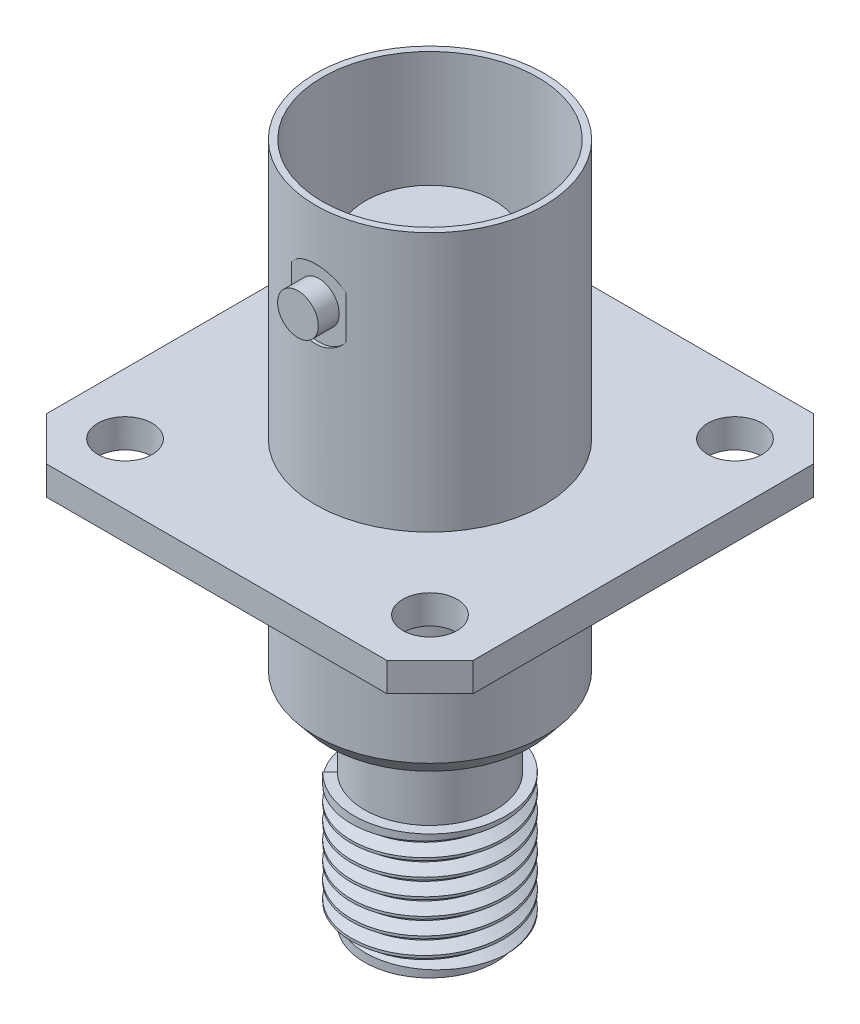
from build123d import *
from build123d.topology import SkipClean

# Parameters (mm, degrees)
BOSS_EXTRUDE2_START = 4.5
SKETCH5_R           = 0.846945363
BOSS_EXTRUDE2_DEPTH = 1
SKETCH6_R           = 0.645187132
CUT_EXTRUDE1_DEPTH  = 5
SKETCH9_W           = 0.137399245
SKETCH9_H           = 0.594121804
BOSS_EXTRUDE3_START = 3
BOSS_EXTRUDE3_DEPTH = 3
SKETCH14_W          = 17.78
SKETCH14_H          = 17.78
BOSS_EXTRUDE4_DEPTH = 1.2
SKETCH11_R          = 0.94402027
CUT_EXTRUDE2_DEPTH  = 3
SKETCH13_R          = 0.99938664
SKETCH13_R_2        = 0.759397748
CUT_EXTRUDE4_DEPTH  = 4
CUT_EXTRUDE5_REACH  = 22.361
SKETCH15_R          = 1.1303
SKETCH16_W          = 33.761193886
SKETCH16_H          = 12.105905612
CUT_EXTRUDE6_DEPTH  = 7
SKETCH17_R          = 2.7305
SKETCH17_R_2        = 2.05
BOSS_EXTRUDE5_DEPTH = 8
BOSS_EXTRUDE6_START = -5
SKETCH18_R          = 3.16357
SKETCH18_R_2        = 2.05
BOSS_EXTRUDE6_DEPTH = 5
SKETCH19_R          = 2.7305
SKETCH19_R_2        = 2.05
BOSS_EXTRUDE7_DEPTH = 0.5
CUT_SWEEP1_PITCH    = 0.7055
SKETCH22_R          = 2.05
BOSS_EXTRUDE8_DEPTH = 24.264969419


with BuildPart() as part:
    # Sketch1 → Revolve1 (revolve)
    with BuildSketch(Plane.XY, mode=Mode.PRIVATE) as revolve1_sk:
        Polygon((0, 7.249356935), (-2.68096621, 7.249356935), (-2.68096621, 0), (-4.484856827, 0), (-4.484856827, 10.8), (-4.7625, 10.8), (-4.7625, 0), (-6.35, 0), (-6.35, -1.2), (-4.7625, -1.2), (-4.7625, -8.33684753), (-4.138651138, -9.1), (-4.138651138, -11.4), (-1.05, -11.4), (-1.05, -13.015612484), (0, -13.015612484), align=None)
    revolve(revolve1_sk.sketch.rotate(Axis((0, 72.402332312, 0), (0, -1, 0)), 270), axis=Axis((0, 72.402332312, 0), (0, -1, 0)))

    # Sketch5 → Boss-Extrude2 (add)
    with BuildSketch(Plane.XY.offset(BOSS_EXTRUDE2_START)):
        with Locations(Location((0, 7.245112304, 0), (0, 0, 270))):
            Circle(SKETCH5_R)
    boss_extrude2 = extrude(amount=BOSS_EXTRUDE2_DEPTH)

    # Mirror1: Boss-Extrude2 across plane
    add(boss_extrude2.mirror(Plane.XY))

    # Sketch6 → Cut-Extrude1 (cut)
    with BuildSketch(Plane(origin=(0, 7.249356935, 0), x_dir=(1, 0, 0), z_dir=(0, 1, 0))):
        with Locations(Location((0, 0, 0), (0, 0, 270))):
            Circle(SKETCH6_R)
    extrude(amount=-CUT_EXTRUDE1_DEPTH, mode=Mode.SUBTRACT)

    # Sketch9 → Cut-Revolve2 (revolve, cut)
    with SkipClean():  # the faces are left unmerged after this step: merging them gives an invalid solid
        with BuildSketch(Plane(origin=(0, 0, 0), x_dir=(0, 0, -1), z_dir=(1, 0, 0)), mode=Mode.PRIVATE) as cut_revolve2_sk:
            with Locations((4.693800378, 8.389118569)):
                Rectangle(SKETCH9_W, SKETCH9_H)
            with Locations((-4.693800378, 8.389118569)):
                Rectangle(SKETCH9_W, SKETCH9_H)
        revolve(cut_revolve2_sk.sketch.rotate(Axis((0, 7.245112304, 5.5), (0, 0, -1)), 90), axis=Axis((0, 7.245112304, 5.5), (0, 0, -1)), mode=Mode.SUBTRACT)

    # Sketch10 → Boss-Extrude3 (add)
    with SkipClean():  # the faces are left unmerged after this step: merging them gives an invalid solid
        with BuildSketch(Plane.XZ.offset(13.015612484).offset(BOSS_EXTRUDE3_START)):
            with BuildLine():
                Line((0.94402027, 0), (1.05, 0))
                ThreePointArc((1.05, 0), (0, 1.05), (-1.05, 0))
                Line((-1.05, 0), (-0.94402027, 0))
                ThreePointArc((-0.94402027, 0), (0, 0.94402027), (0.94402027, 0))
            make_face()
        extrude(amount=-BOSS_EXTRUDE3_DEPTH)

    # Sketch14 → Boss-Extrude4 (add)
    with SkipClean():  # the faces are left unmerged after this step: merging them gives an invalid solid
        with BuildSketch(Plane.XZ.offset(1.2)):
            Rectangle(SKETCH14_W, SKETCH14_H)
        extrude(amount=-BOSS_EXTRUDE4_DEPTH)

    # Sketch11 → Cut-Extrude2 (cut)
    with SkipClean():  # the faces are left unmerged after this step: merging them gives an invalid solid
        with BuildSketch(Plane.XZ.offset(13.015612484)):
            Circle(SKETCH11_R)
        extrude(amount=-CUT_EXTRUDE2_DEPTH, mode=Mode.SUBTRACT)

    # Sketch13 → Cut-Extrude4 (cut)
    with SkipClean():  # the faces are left unmerged after this step: merging them gives an invalid solid
        with BuildSketch(Plane(origin=(0, 7.249356935, 0), x_dir=(1, 0, 0), z_dir=(0, 1, 0))):
            with Locations(Location((0, 0, 0), (0, 0, 270))):
                Circle(SKETCH13_R)
            with Locations(Location((0, 0, 0), (0, 0, 270))):
                Circle(SKETCH13_R_2, mode=Mode.SUBTRACT)
        extrude(amount=-CUT_EXTRUDE4_DEPTH, mode=Mode.SUBTRACT)

    # Sketch15 → Cut-Extrude5 (cut, up to next)
    with BuildSketch(Plane(origin=(0, 0, 0), x_dir=(1, 0, 0), z_dir=(0, 1, 0)), mode=Mode.PRIVATE) as cut_extrude5_sk1:
        with Locations(Location((-6.35, 6.35, 0), (0, 0, 270))):
            Circle(SKETCH15_R)
    cut_extrude5_tool1 = extrude(cut_extrude5_sk1.sketch, amount=-CUT_EXTRUDE5_REACH, mode=Mode.PRIVATE) & part.part
    # Sketch15 → Cut-Extrude5 (cut, up to next)
    with BuildSketch(Plane(origin=(0, 0, 0), x_dir=(1, 0, 0), z_dir=(0, 1, 0)), mode=Mode.PRIVATE) as cut_extrude5_sk2:
        with Locations(Location((6.35, 6.35, 0), (0, 0, 270))):
            Circle(SKETCH15_R)
    cut_extrude5_tool2 = extrude(cut_extrude5_sk2.sketch, amount=-CUT_EXTRUDE5_REACH, mode=Mode.PRIVATE) & part.part
    # Sketch15 → Cut-Extrude5 (cut, up to next)
    with BuildSketch(Plane(origin=(0, 0, 0), x_dir=(1, 0, 0), z_dir=(0, 1, 0)), mode=Mode.PRIVATE) as cut_extrude5_sk3:
        with Locations(Location((6.35, -6.35, 0), (0, 0, 270))):
            Circle(SKETCH15_R)
    cut_extrude5_tool3 = extrude(cut_extrude5_sk3.sketch, amount=-CUT_EXTRUDE5_REACH, mode=Mode.PRIVATE) & part.part
    # Sketch15 → Cut-Extrude5 (cut, up to next)
    with BuildSketch(Plane(origin=(0, 0, 0), x_dir=(1, 0, 0), z_dir=(0, 1, 0)), mode=Mode.PRIVATE) as cut_extrude5_sk4:
        with Locations(Location((-6.35, -6.35, 0), (0, 0, 270))):
            Circle(SKETCH15_R)
    cut_extrude5_tool4 = extrude(cut_extrude5_sk4.sketch, amount=-CUT_EXTRUDE5_REACH, mode=Mode.PRIVATE) & part.part
    # Sketch15 → Cut-Extrude5 (cut, up to next)
    with BuildSketch(Plane(origin=(0, 0, 0), x_dir=(1, 0, 0), z_dir=(0, 1, 0)), mode=Mode.PRIVATE) as cut_extrude5_sk5:
        Polygon((-8.89, 7.09), (-7.09, 8.89), (-8.89, 8.89), align=None)
    cut_extrude5_tool5 = extrude(cut_extrude5_sk5.sketch, amount=-CUT_EXTRUDE5_REACH, mode=Mode.PRIVATE) & part.part
    # Sketch15 → Cut-Extrude5 (cut, up to next)
    with BuildSketch(Plane(origin=(0, 0, 0), x_dir=(1, 0, 0), z_dir=(0, 1, 0)), mode=Mode.PRIVATE) as cut_extrude5_sk6:
        Polygon((7.09, -8.89), (8.89, -7.09), (8.89, -8.89), align=None)
    cut_extrude5_tool6 = extrude(cut_extrude5_sk6.sketch, amount=-CUT_EXTRUDE5_REACH, mode=Mode.PRIVATE) & part.part
    # Sketch15 → Cut-Extrude5 (cut, up to next)
    with BuildSketch(Plane(origin=(0, 0, 0), x_dir=(1, 0, 0), z_dir=(0, 1, 0)), mode=Mode.PRIVATE) as cut_extrude5_sk7:
        Polygon((8.89, 8.89), (7.09, 8.89), (8.89, 7.09), align=None)
    cut_extrude5_tool7 = extrude(cut_extrude5_sk7.sketch, amount=-CUT_EXTRUDE5_REACH, mode=Mode.PRIVATE) & part.part
    # Sketch15 → Cut-Extrude5 (cut, up to next)
    with BuildSketch(Plane(origin=(0, 0, 0), x_dir=(1, 0, 0), z_dir=(0, 1, 0)), mode=Mode.PRIVATE) as cut_extrude5_sk8:
        Polygon((-8.89, -8.89), (-7.09, -8.89), (-8.89, -7.09), align=None)
    cut_extrude5_tool8 = extrude(cut_extrude5_sk8.sketch, amount=-CUT_EXTRUDE5_REACH, mode=Mode.PRIVATE) & part.part
    add(cut_extrude5_tool1.solids().sort_by_distance((-6.35, 0, -6.35))[0], mode=Mode.SUBTRACT)
    add(cut_extrude5_tool2.solids().sort_by_distance((6.35, 0, -6.35))[0], mode=Mode.SUBTRACT)
    add(cut_extrude5_tool3.solids().sort_by_distance((6.35, 0, 6.35))[0], mode=Mode.SUBTRACT)
    add(cut_extrude5_tool4.solids().sort_by_distance((-6.35, 0, 6.35))[0], mode=Mode.SUBTRACT)
    add(cut_extrude5_tool5.solids().sort_by_distance((-8.29, 0, -8.29))[0], mode=Mode.SUBTRACT)
    add(cut_extrude5_tool6.solids().sort_by_distance((8.29, 0, 8.29))[0], mode=Mode.SUBTRACT)
    add(cut_extrude5_tool7.solids().sort_by_distance((8.29, 0, -8.29))[0], mode=Mode.SUBTRACT)
    add(cut_extrude5_tool8.solids().sort_by_distance((-8.29, 0, 8.29))[0], mode=Mode.SUBTRACT)

    # Sketch16 → Cut-Extrude6 (cut)
    with SkipClean():  # the faces are left unmerged after this step: merging them gives an invalid solid
        with BuildSketch(Plane.XZ.offset(16.015612484)):
            with Locations((2.079843597, 0.280079531)):
                Rectangle(SKETCH16_W, SKETCH16_H)
        extrude(amount=-CUT_EXTRUDE6_DEPTH, mode=Mode.SUBTRACT)

    # Sketch17 → Boss-Extrude5 (add)
    with SkipClean():  # the faces are left unmerged after this step: merging them gives an invalid solid
        with BuildSketch(Plane.XZ.offset(9.015612484)):
            with Locations(Location((0, 0, 0), (0, 0, 270))):
                Circle(SKETCH17_R)
            with Locations(Location((0, 0, 0), (0, 0, 270))):
                Circle(SKETCH17_R_2, mode=Mode.SUBTRACT)
        extrude(amount=BOSS_EXTRUDE5_DEPTH)

    # Sketch18 → Boss-Extrude6 (add)
    with SkipClean():  # the faces are left unmerged after this step: merging them gives an invalid solid
        with BuildSketch(Plane.XZ.offset(17.015612484).offset(BOSS_EXTRUDE6_START)):
            with Locations(Location((0, 0, 0), (0, 0, 270))):
                Circle(SKETCH18_R)
            with Locations(Location((0, 0, 0), (0, 0, 270))):
                Circle(SKETCH18_R_2, mode=Mode.SUBTRACT)
        extrude(amount=BOSS_EXTRUDE6_DEPTH)

    # Sketch19 → Boss-Extrude7 (add)
    with SkipClean():  # the faces are left unmerged after this step: merging them gives an invalid solid
        with BuildSketch(Plane.XZ.offset(17.015612484)):
            with Locations(Location((0, 0, 0), (0, 0, 270))):
                Circle(SKETCH19_R)
            with Locations(Location((0, 0, 0), (0, 0, 270))):
                Circle(SKETCH19_R_2, mode=Mode.SUBTRACT)
        extrude(amount=BOSS_EXTRUDE7_DEPTH)

    # Cut-Sweep1: arcs per turn and ends read off the stored shape
    # Cut-Sweep1: the profile of Sketch21 profile screwed along a right-hand helix through 8 turns, 6 arcs to a turn; built about Z, then put on its axis
    with SkipClean():  # the faces are left unmerged after this step: merging them gives an invalid solid
        cut_sweep1_z = Axis((0, 0, 0), (0, 0, 1))
        cut_sweep1_corners = [(2.7302, 0, -0.617485705), (2.7302, 0, -0.717139295), (3.1805, 0, -0.977120121), (3.1805, 0, -0.357504879)]
        with BuildLine(mode=Mode.PRIVATE) as cut_sweep1_profile:
            Line(cut_sweep1_corners[0], cut_sweep1_corners[1])
            Line(cut_sweep1_corners[1], cut_sweep1_corners[2])
            Line(cut_sweep1_corners[2], cut_sweep1_corners[3])
            Line(cut_sweep1_corners[3], cut_sweep1_corners[0])
        cut_sweep1_cap = Face(cut_sweep1_profile.wire())
        cut_sweep1_turn_angles = [0, 30, 60, 90, 120, 150, 180, 210, 240, 270, 300, 330, 360]
        cut_sweep1_turn_weights = [1, 0.8660254037844387, 1, 0.8660254037844387, 1, 0.8660254037844387, 1, 0.8660254037844387, 1, 0.8660254037844387, 1, 0.8660254037844387, 1]
        cut_sweep1_turn_rails = [Edge.make_bspline([Vector(p[0], p[1], 0).rotate(cut_sweep1_z, cut_sweep1_turn_angles[k]) / cut_sweep1_turn_weights[k] + Vector(0, 0, p[2] + CUT_SWEEP1_PITCH * cut_sweep1_turn_angles[k] / 360) for k in range(13)], [0, 0, 0, 1, 1, 2, 2, 3, 3, 4, 4, 5, 5, 6, 6, 6], 2, cut_sweep1_turn_weights) for p in cut_sweep1_corners]
        cut_sweep1_turn_sides = [Face.make_surface_from_curves(cut_sweep1_turn_rails[p[0]], cut_sweep1_turn_rails[p[1]]) for p in [(0, 1), (1, 2), (2, 3), (3, 0)]]
        cut_sweep1 = Plane(origin=(0, -17.015612484, 0), x_dir=(-0.7071067811865537, 0, 0.7071067811865414), z_dir=(0, 1, 0)) * Solid(Shell([*[p.moved(Location((0, 0, CUT_SWEEP1_PITCH * i))) for i in range(8) for p in cut_sweep1_turn_sides], cut_sweep1_cap, cut_sweep1_cap.rotate(cut_sweep1_z, 2880).moved(Location((0, 0, CUT_SWEEP1_PITCH * 2880 / 360)))]))
        add(cut_sweep1, mode=Mode.SUBTRACT)

    # Sketch22 → Boss-Extrude8 (add)
    with SkipClean():  # the faces are left unmerged after this step: merging them gives an invalid solid
        with BuildSketch(Plane(origin=(0, 7.249356935, 0), x_dir=(1, 0, 0), z_dir=(0, 1, 0))):
            with Locations(Location((0, 0, 0), (0, 0, 90))):
                Circle(SKETCH22_R)
        extrude(amount=-BOSS_EXTRUDE8_DEPTH)


solid = part.part
